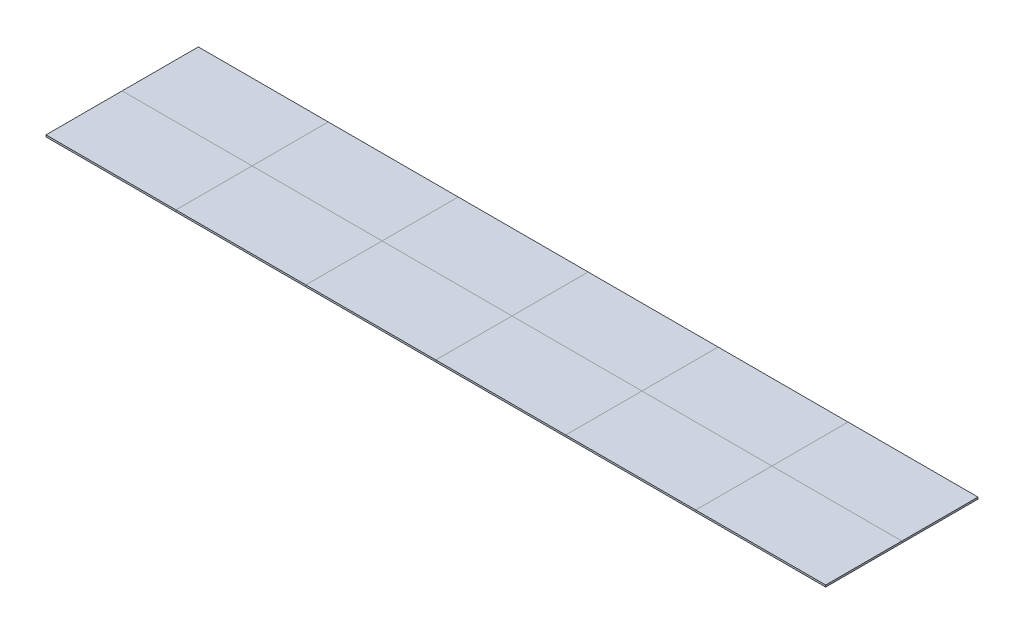
from build123d import *

# Parameters (mm, degrees)
SKETCH1_W                 = 12026.9
SKETCH1_H                 = 2349.5
BOSS_EXTRUDE1_DEPTH       = 27.94
SPLIT1_SURFACE_1_1_BACK   = 12255.275
SPLIT1_SURFACE_1_1_DEPTH  = 24510.55
SPLIT1_SURFACE_1_2_BACK   = 12255.275
SPLIT1_SURFACE_1_2_DEPTH  = 24510.55
SPLIT1_SURFACE_2_3_BACK   = 12255.275
SPLIT1_SURFACE_2_3_DEPTH  = 24510.55
SPLIT1_SURFACE_2_4_BACK   = 12255.275
SPLIT1_SURFACE_2_4_DEPTH  = 24510.55
SPLIT1_SURFACE_2_5_BACK   = 12255.275
SPLIT1_SURFACE_2_5_DEPTH  = 24510.55
SPLIT1_SURFACE_2_6_BACK   = 12255.275
SPLIT1_SURFACE_2_6_DEPTH  = 24510.55
SPLIT1_SURFACE_3_7_BACK   = 12255.275
SPLIT1_SURFACE_3_7_DEPTH  = 24510.55
SPLIT1_SURFACE_3_8_BACK   = 12255.275
SPLIT1_SURFACE_3_8_DEPTH  = 24510.55
SPLIT1_SURFACE_3_9_BACK   = 12255.275
SPLIT1_SURFACE_3_9_DEPTH  = 24510.55
SPLIT1_SURFACE_3_10_BACK  = 12255.275
SPLIT1_SURFACE_3_10_DEPTH = 24510.55
SPLIT1_SURFACE_4_11_BACK  = 12255.275
SPLIT1_SURFACE_4_11_DEPTH = 24510.55
SPLIT1_SURFACE_4_12_BACK  = 12255.275
SPLIT1_SURFACE_4_12_DEPTH = 24510.55
SPLIT1_SURFACE_4_13_BACK  = 12255.275
SPLIT1_SURFACE_4_13_DEPTH = 24510.55
SPLIT1_SURFACE_4_14_BACK  = 12255.275
SPLIT1_SURFACE_4_14_DEPTH = 24510.55
SPLIT1_SURFACE_5_15_BACK  = 12255.275
SPLIT1_SURFACE_5_15_DEPTH = 24510.55
SPLIT1_SURFACE_5_16_BACK  = 12255.275
SPLIT1_SURFACE_5_16_DEPTH = 24510.55
SPLIT1_SURFACE_5_17_BACK  = 12255.275
SPLIT1_SURFACE_5_17_DEPTH = 24510.55
SPLIT1_SURFACE_5_18_BACK  = 12255.275
SPLIT1_SURFACE_5_18_DEPTH = 24510.55
SPLIT1_SURFACE_6_19_BACK  = 12255.275
SPLIT1_SURFACE_6_19_DEPTH = 24510.55
SPLIT1_SURFACE_6_20_BACK  = 12255.275
SPLIT1_SURFACE_6_20_DEPTH = 24510.55
SPLIT1_SURFACE_6_21_BACK  = 12255.275
SPLIT1_SURFACE_6_21_DEPTH = 24510.55
SPLIT1_SURFACE_6_22_BACK  = 12255.275
SPLIT1_SURFACE_6_22_DEPTH = 24510.55


with BuildPart() as part:
    # Sketch1 → Boss-Extrude1 (new body)
    with BuildSketch(Plane(origin=(0, 0, 0), x_dir=(1, 0, 0), z_dir=(0, 1, 0))):
        with Locations((6013.45, 1174.75)):
            Rectangle(SKETCH1_W, SKETCH1_H)
    extrude(amount=BOSS_EXTRUDE1_DEPTH)


with BuildPart() as body_2:
    # Split1: the piece behind the surface
    add(part.part)
    # Split1 surface 1: a surface, the sketch's curves swept straight by 24510.55 mm
    with BuildLine(Plane(origin=(0, 0, 0), x_dir=(1, 0, 0), z_dir=(0, 1, 0)).offset(-SPLIT1_SURFACE_1_1_BACK), mode=Mode.PRIVATE) as split1_surface_1_1_path:
        Line((0, 1174.75), (12026.9, 1174.75))
    split1_surface_1_1 = Shell.extrude(split1_surface_1_1_path.wire(), (0 * SPLIT1_SURFACE_1_1_DEPTH, 1 * SPLIT1_SURFACE_1_1_DEPTH, 0 * SPLIT1_SURFACE_1_1_DEPTH))
    split(bisect_by=split1_surface_1_1, keep=Keep.BOTTOM)


with BuildPart() as part_1:
    add(part.part)

    # Split1: split by a surface, the side it looks to stays
    # Split1 surface 1: a surface, the sketch's curves swept straight by 24510.55 mm
    with BuildLine(Plane(origin=(0, 0, 0), x_dir=(1, 0, 0), z_dir=(0, 1, 0)).offset(-SPLIT1_SURFACE_1_2_BACK), mode=Mode.PRIVATE) as split1_surface_1_2_path:
        Line((0, 1174.75), (12026.9, 1174.75))
    split1_surface_1_2 = Shell.extrude(split1_surface_1_2_path.wire(), (0 * SPLIT1_SURFACE_1_2_DEPTH, 1 * SPLIT1_SURFACE_1_2_DEPTH, 0 * SPLIT1_SURFACE_1_2_DEPTH))
    split(bisect_by=split1_surface_1_2, keep=Keep.TOP)


with BuildPart() as body_3:
    # Split1 2: the piece behind the surface
    add(part_1.part)
    # Split1 surface 2: a surface, the sketch's curves swept straight by 24510.55 mm
    with BuildLine(Plane(origin=(0, 0, 0), x_dir=(1, 0, 0), z_dir=(0, 1, 0)).offset(-SPLIT1_SURFACE_2_3_BACK), mode=Mode.PRIVATE) as split1_surface_2_3_path:
        Line((2004.483333333, 0), (2004.483333333, 2349.5))
    split1_surface_2_3 = Shell.extrude(split1_surface_2_3_path.wire(), (0 * SPLIT1_SURFACE_2_3_DEPTH, 1 * SPLIT1_SURFACE_2_3_DEPTH, 0 * SPLIT1_SURFACE_2_3_DEPTH))
    split(bisect_by=split1_surface_2_3, keep=Keep.BOTTOM)


with BuildPart() as part_2:
    add(part_1.part)

    # Split1 2: split by a surface, the side it looks to stays
    # Split1 surface 2: a surface, the sketch's curves swept straight by 24510.55 mm
    with BuildLine(Plane(origin=(0, 0, 0), x_dir=(1, 0, 0), z_dir=(0, 1, 0)).offset(-SPLIT1_SURFACE_2_4_BACK), mode=Mode.PRIVATE) as split1_surface_2_4_path:
        Line((2004.483333333, 0), (2004.483333333, 2349.5))
    split1_surface_2_4 = Shell.extrude(split1_surface_2_4_path.wire(), (0 * SPLIT1_SURFACE_2_4_DEPTH, 1 * SPLIT1_SURFACE_2_4_DEPTH, 0 * SPLIT1_SURFACE_2_4_DEPTH))
    split(bisect_by=split1_surface_2_4, keep=Keep.TOP)


with BuildPart() as body_4:
    # Split1 2 body 2: the piece behind the surface
    add(body_2.part)
    # Split1 surface 2: a surface, the sketch's curves swept straight by 24510.55 mm
    with BuildLine(Plane(origin=(0, 0, 0), x_dir=(1, 0, 0), z_dir=(0, 1, 0)).offset(-SPLIT1_SURFACE_2_5_BACK), mode=Mode.PRIVATE) as split1_surface_2_5_path:
        Line((2004.483333333, 0), (2004.483333333, 2349.5))
    split1_surface_2_5 = Shell.extrude(split1_surface_2_5_path.wire(), (0 * SPLIT1_SURFACE_2_5_DEPTH, 1 * SPLIT1_SURFACE_2_5_DEPTH, 0 * SPLIT1_SURFACE_2_5_DEPTH))
    split(bisect_by=split1_surface_2_5, keep=Keep.BOTTOM)


with BuildPart() as body_2_1:
    add(body_2.part)

    # Split1 2 body 2: split by a surface, the side it looks to stays
    # Split1 surface 2: a surface, the sketch's curves swept straight by 24510.55 mm
    with BuildLine(Plane(origin=(0, 0, 0), x_dir=(1, 0, 0), z_dir=(0, 1, 0)).offset(-SPLIT1_SURFACE_2_6_BACK), mode=Mode.PRIVATE) as split1_surface_2_6_path:
        Line((2004.483333333, 0), (2004.483333333, 2349.5))
    split1_surface_2_6 = Shell.extrude(split1_surface_2_6_path.wire(), (0 * SPLIT1_SURFACE_2_6_DEPTH, 1 * SPLIT1_SURFACE_2_6_DEPTH, 0 * SPLIT1_SURFACE_2_6_DEPTH))
    split(bisect_by=split1_surface_2_6, keep=Keep.TOP)


with BuildPart() as body_5:
    # Split1 3 body 3: the piece behind the surface
    add(body_3.part)
    # Split1 surface 3: a surface, the sketch's curves swept straight by 24510.55 mm
    with BuildLine(Plane(origin=(0, 0, 0), x_dir=(1, 0, 0), z_dir=(0, 1, 0)).offset(-SPLIT1_SURFACE_3_7_BACK), mode=Mode.PRIVATE) as split1_surface_3_7_path:
        Line((4008.966666667, 0), (4008.966666667, 2349.5))
    split1_surface_3_7 = Shell.extrude(split1_surface_3_7_path.wire(), (0 * SPLIT1_SURFACE_3_7_DEPTH, 1 * SPLIT1_SURFACE_3_7_DEPTH, 0 * SPLIT1_SURFACE_3_7_DEPTH))
    split(bisect_by=split1_surface_3_7, keep=Keep.BOTTOM)


with BuildPart() as body_3_1:
    add(body_3.part)

    # Split1 3 body 3: split by a surface, the side it looks to stays
    # Split1 surface 3: a surface, the sketch's curves swept straight by 24510.55 mm
    with BuildLine(Plane(origin=(0, 0, 0), x_dir=(1, 0, 0), z_dir=(0, 1, 0)).offset(-SPLIT1_SURFACE_3_8_BACK), mode=Mode.PRIVATE) as split1_surface_3_8_path:
        Line((4008.966666667, 0), (4008.966666667, 2349.5))
    split1_surface_3_8 = Shell.extrude(split1_surface_3_8_path.wire(), (0 * SPLIT1_SURFACE_3_8_DEPTH, 1 * SPLIT1_SURFACE_3_8_DEPTH, 0 * SPLIT1_SURFACE_3_8_DEPTH))
    split(bisect_by=split1_surface_3_8, keep=Keep.TOP)


with BuildPart() as body_6:
    # Split1 3 body 4: the piece behind the surface
    add(body_4.part)
    # Split1 surface 3: a surface, the sketch's curves swept straight by 24510.55 mm
    with BuildLine(Plane(origin=(0, 0, 0), x_dir=(1, 0, 0), z_dir=(0, 1, 0)).offset(-SPLIT1_SURFACE_3_9_BACK), mode=Mode.PRIVATE) as split1_surface_3_9_path:
        Line((4008.966666667, 0), (4008.966666667, 2349.5))
    split1_surface_3_9 = Shell.extrude(split1_surface_3_9_path.wire(), (0 * SPLIT1_SURFACE_3_9_DEPTH, 1 * SPLIT1_SURFACE_3_9_DEPTH, 0 * SPLIT1_SURFACE_3_9_DEPTH))
    split(bisect_by=split1_surface_3_9, keep=Keep.BOTTOM)


with BuildPart() as body_4_1:
    add(body_4.part)

    # Split1 3 body 4: split by a surface, the side it looks to stays
    # Split1 surface 3: a surface, the sketch's curves swept straight by 24510.55 mm
    with BuildLine(Plane(origin=(0, 0, 0), x_dir=(1, 0, 0), z_dir=(0, 1, 0)).offset(-SPLIT1_SURFACE_3_10_BACK), mode=Mode.PRIVATE) as split1_surface_3_10_path:
        Line((4008.966666667, 0), (4008.966666667, 2349.5))
    split1_surface_3_10 = Shell.extrude(split1_surface_3_10_path.wire(), (0 * SPLIT1_SURFACE_3_10_DEPTH, 1 * SPLIT1_SURFACE_3_10_DEPTH, 0 * SPLIT1_SURFACE_3_10_DEPTH))
    split(bisect_by=split1_surface_3_10, keep=Keep.TOP)


with BuildPart() as body_7:
    # Split1 4 body 5: the piece behind the surface
    add(body_5.part)
    # Split1 surface 4: a surface, the sketch's curves swept straight by 24510.55 mm
    with BuildLine(Plane(origin=(0, 0, 0), x_dir=(1, 0, 0), z_dir=(0, 1, 0)).offset(-SPLIT1_SURFACE_4_11_BACK), mode=Mode.PRIVATE) as split1_surface_4_11_path:
        Line((10022.416666667, 0), (10022.416666667, 2349.5))
    split1_surface_4_11 = Shell.extrude(split1_surface_4_11_path.wire(), (0 * SPLIT1_SURFACE_4_11_DEPTH, 1 * SPLIT1_SURFACE_4_11_DEPTH, 0 * SPLIT1_SURFACE_4_11_DEPTH))
    split(bisect_by=split1_surface_4_11, keep=Keep.BOTTOM)


with BuildPart() as body_5_1:
    add(body_5.part)

    # Split1 4 body 5: split by a surface, the side it looks to stays
    # Split1 surface 4: a surface, the sketch's curves swept straight by 24510.55 mm
    with BuildLine(Plane(origin=(0, 0, 0), x_dir=(1, 0, 0), z_dir=(0, 1, 0)).offset(-SPLIT1_SURFACE_4_12_BACK), mode=Mode.PRIVATE) as split1_surface_4_12_path:
        Line((10022.416666667, 0), (10022.416666667, 2349.5))
    split1_surface_4_12 = Shell.extrude(split1_surface_4_12_path.wire(), (0 * SPLIT1_SURFACE_4_12_DEPTH, 1 * SPLIT1_SURFACE_4_12_DEPTH, 0 * SPLIT1_SURFACE_4_12_DEPTH))
    split(bisect_by=split1_surface_4_12, keep=Keep.TOP)


with BuildPart() as body_8:
    # Split1 4 body 6: the piece behind the surface
    add(body_6.part)
    # Split1 surface 4: a surface, the sketch's curves swept straight by 24510.55 mm
    with BuildLine(Plane(origin=(0, 0, 0), x_dir=(1, 0, 0), z_dir=(0, 1, 0)).offset(-SPLIT1_SURFACE_4_13_BACK), mode=Mode.PRIVATE) as split1_surface_4_13_path:
        Line((10022.416666667, 0), (10022.416666667, 2349.5))
    split1_surface_4_13 = Shell.extrude(split1_surface_4_13_path.wire(), (0 * SPLIT1_SURFACE_4_13_DEPTH, 1 * SPLIT1_SURFACE_4_13_DEPTH, 0 * SPLIT1_SURFACE_4_13_DEPTH))
    split(bisect_by=split1_surface_4_13, keep=Keep.BOTTOM)


with BuildPart() as body_6_1:
    add(body_6.part)

    # Split1 4 body 6: split by a surface, the side it looks to stays
    # Split1 surface 4: a surface, the sketch's curves swept straight by 24510.55 mm
    with BuildLine(Plane(origin=(0, 0, 0), x_dir=(1, 0, 0), z_dir=(0, 1, 0)).offset(-SPLIT1_SURFACE_4_14_BACK), mode=Mode.PRIVATE) as split1_surface_4_14_path:
        Line((10022.416666667, 0), (10022.416666667, 2349.5))
    split1_surface_4_14 = Shell.extrude(split1_surface_4_14_path.wire(), (0 * SPLIT1_SURFACE_4_14_DEPTH, 1 * SPLIT1_SURFACE_4_14_DEPTH, 0 * SPLIT1_SURFACE_4_14_DEPTH))
    split(bisect_by=split1_surface_4_14, keep=Keep.TOP)


with BuildPart() as body_9:
    # Split1 5 body 5: the piece behind the surface
    add(body_5_1.part)
    # Split1 surface 5: a surface, the sketch's curves swept straight by 24510.55 mm
    with BuildLine(Plane(origin=(0, 0, 0), x_dir=(1, 0, 0), z_dir=(0, 1, 0)).offset(-SPLIT1_SURFACE_5_15_BACK), mode=Mode.PRIVATE) as split1_surface_5_15_path:
        Line((8017.933333333, 0), (8017.933333333, 2349.5))
    split1_surface_5_15 = Shell.extrude(split1_surface_5_15_path.wire(), (0 * SPLIT1_SURFACE_5_15_DEPTH, 1 * SPLIT1_SURFACE_5_15_DEPTH, 0 * SPLIT1_SURFACE_5_15_DEPTH))
    split(bisect_by=split1_surface_5_15, keep=Keep.BOTTOM)


with BuildPart() as body_5_2:
    add(body_5_1.part)

    # Split1 5 body 5: split by a surface, the side it looks to stays
    # Split1 surface 5: a surface, the sketch's curves swept straight by 24510.55 mm
    with BuildLine(Plane(origin=(0, 0, 0), x_dir=(1, 0, 0), z_dir=(0, 1, 0)).offset(-SPLIT1_SURFACE_5_16_BACK), mode=Mode.PRIVATE) as split1_surface_5_16_path:
        Line((8017.933333333, 0), (8017.933333333, 2349.5))
    split1_surface_5_16 = Shell.extrude(split1_surface_5_16_path.wire(), (0 * SPLIT1_SURFACE_5_16_DEPTH, 1 * SPLIT1_SURFACE_5_16_DEPTH, 0 * SPLIT1_SURFACE_5_16_DEPTH))
    split(bisect_by=split1_surface_5_16, keep=Keep.TOP)


with BuildPart() as body_10:
    # Split1 5 body 6: the piece behind the surface
    add(body_6_1.part)
    # Split1 surface 5: a surface, the sketch's curves swept straight by 24510.55 mm
    with BuildLine(Plane(origin=(0, 0, 0), x_dir=(1, 0, 0), z_dir=(0, 1, 0)).offset(-SPLIT1_SURFACE_5_17_BACK), mode=Mode.PRIVATE) as split1_surface_5_17_path:
        Line((8017.933333333, 0), (8017.933333333, 2349.5))
    split1_surface_5_17 = Shell.extrude(split1_surface_5_17_path.wire(), (0 * SPLIT1_SURFACE_5_17_DEPTH, 1 * SPLIT1_SURFACE_5_17_DEPTH, 0 * SPLIT1_SURFACE_5_17_DEPTH))
    split(bisect_by=split1_surface_5_17, keep=Keep.BOTTOM)


with BuildPart() as body_6_2:
    add(body_6_1.part)

    # Split1 5 body 6: split by a surface, the side it looks to stays
    # Split1 surface 5: a surface, the sketch's curves swept straight by 24510.55 mm
    with BuildLine(Plane(origin=(0, 0, 0), x_dir=(1, 0, 0), z_dir=(0, 1, 0)).offset(-SPLIT1_SURFACE_5_18_BACK), mode=Mode.PRIVATE) as split1_surface_5_18_path:
        Line((8017.933333333, 0), (8017.933333333, 2349.5))
    split1_surface_5_18 = Shell.extrude(split1_surface_5_18_path.wire(), (0 * SPLIT1_SURFACE_5_18_DEPTH, 1 * SPLIT1_SURFACE_5_18_DEPTH, 0 * SPLIT1_SURFACE_5_18_DEPTH))
    split(bisect_by=split1_surface_5_18, keep=Keep.TOP)


with BuildPart() as body_11_2:
    # Split1 6 body 5: the piece behind the surface
    add(body_5_2.part)
    # Split1 surface 6: a surface, the sketch's curves swept straight by 24510.55 mm
    with BuildLine(Plane(origin=(0, 0, 0), x_dir=(1, 0, 0), z_dir=(0, 1, 0)).offset(-SPLIT1_SURFACE_6_19_BACK), mode=Mode.PRIVATE) as split1_surface_6_19_path:
        Line((6013.45, 0), (6013.45, 2349.5))
    split1_surface_6_19 = Shell.extrude(split1_surface_6_19_path.wire(), (0 * SPLIT1_SURFACE_6_19_DEPTH, 1 * SPLIT1_SURFACE_6_19_DEPTH, 0 * SPLIT1_SURFACE_6_19_DEPTH))
    split(bisect_by=split1_surface_6_19, keep=Keep.BOTTOM)


with BuildPart() as body_5_3:
    add(body_5_2.part)

    # Split1 6 body 5: split by a surface, the side it looks to stays
    # Split1 surface 6: a surface, the sketch's curves swept straight by 24510.55 mm
    with BuildLine(Plane(origin=(0, 0, 0), x_dir=(1, 0, 0), z_dir=(0, 1, 0)).offset(-SPLIT1_SURFACE_6_20_BACK), mode=Mode.PRIVATE) as split1_surface_6_20_path:
        Line((6013.45, 0), (6013.45, 2349.5))
    split1_surface_6_20 = Shell.extrude(split1_surface_6_20_path.wire(), (0 * SPLIT1_SURFACE_6_20_DEPTH, 1 * SPLIT1_SURFACE_6_20_DEPTH, 0 * SPLIT1_SURFACE_6_20_DEPTH))
    split(bisect_by=split1_surface_6_20, keep=Keep.TOP)


with BuildPart() as body_12:
    # Split1 6 body 6: the piece behind the surface
    add(body_6_2.part)
    # Split1 surface 6: a surface, the sketch's curves swept straight by 24510.55 mm
    with BuildLine(Plane(origin=(0, 0, 0), x_dir=(1, 0, 0), z_dir=(0, 1, 0)).offset(-SPLIT1_SURFACE_6_21_BACK), mode=Mode.PRIVATE) as split1_surface_6_21_path:
        Line((6013.45, 0), (6013.45, 2349.5))
    split1_surface_6_21 = Shell.extrude(split1_surface_6_21_path.wire(), (0 * SPLIT1_SURFACE_6_21_DEPTH, 1 * SPLIT1_SURFACE_6_21_DEPTH, 0 * SPLIT1_SURFACE_6_21_DEPTH))
    split(bisect_by=split1_surface_6_21, keep=Keep.BOTTOM)


with BuildPart() as body_6_3:
    add(body_6_2.part)

    # Split1 6 body 6: split by a surface, the side it looks to stays
    # Split1 surface 6: a surface, the sketch's curves swept straight by 24510.55 mm
    with BuildLine(Plane(origin=(0, 0, 0), x_dir=(1, 0, 0), z_dir=(0, 1, 0)).offset(-SPLIT1_SURFACE_6_22_BACK), mode=Mode.PRIVATE) as split1_surface_6_22_path:
        Line((6013.45, 0), (6013.45, 2349.5))
    split1_surface_6_22 = Shell.extrude(split1_surface_6_22_path.wire(), (0 * SPLIT1_SURFACE_6_22_DEPTH, 1 * SPLIT1_SURFACE_6_22_DEPTH, 0 * SPLIT1_SURFACE_6_22_DEPTH))
    split(bisect_by=split1_surface_6_22, keep=Keep.TOP)


solid = Compound([part_2.part, body_2_1.part, body_3_1.part, body_4_1.part, body_7.part, body_8.part, body_9.part, body_10.part, body_11_2.part, body_5_3.part, body_12.part, body_6_3.part])
